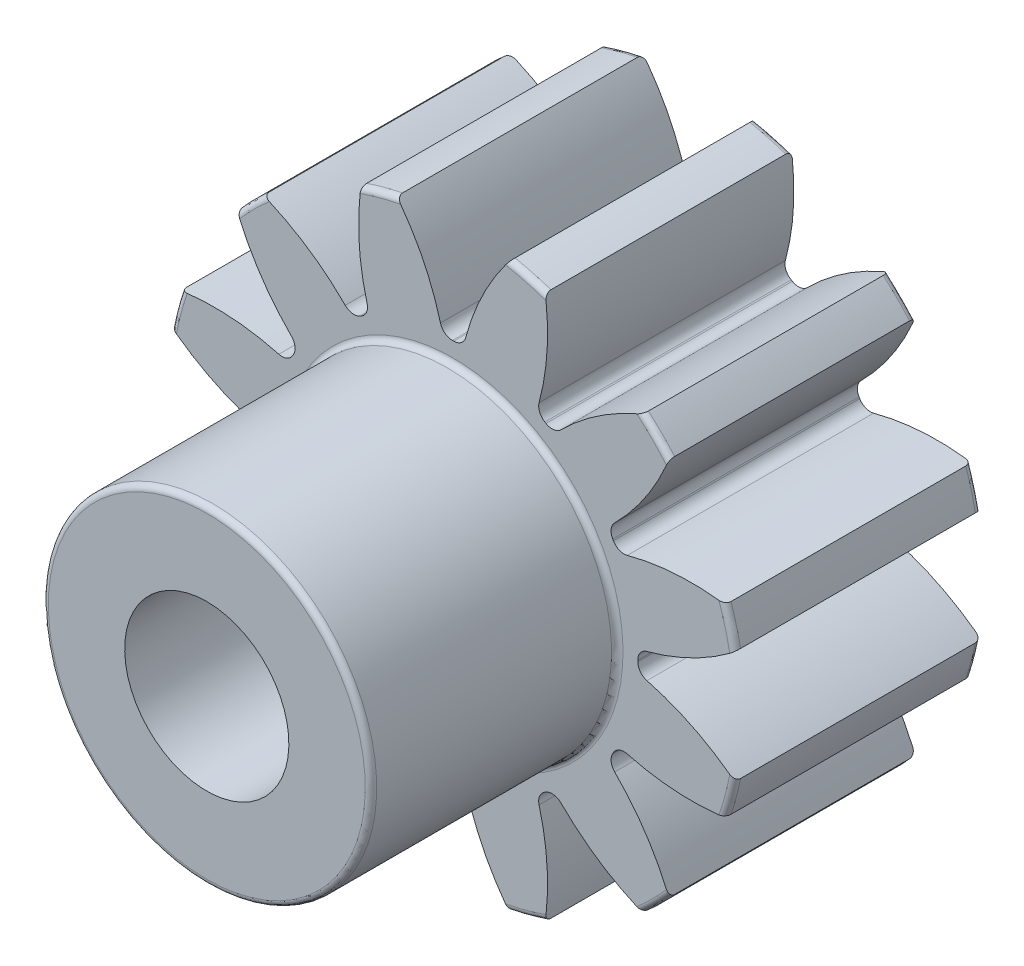
from build123d import *

# Parameters (mm, degrees)
FILLET2_R          = 0.14
CUT_EXTRUDE2_DEPTH = 12.575837024
CIRPATTERN1_COUNT  = 12


with BuildPart() as part:
    # Sketch4 → Revolve1 (revolve)
    with BuildSketch(Plane(origin=(0, 0, 0), x_dir=(0, 0, -1), z_dir=(1, 0, 0))):
        Polygon((-12, 2), (-12, 4), (-6, 4), (-6, 7), (0, 7), (0, 2), align=None)
    revolve(axis=Axis((0, 0, 6), (0, 0, 1)))

    # Fillet2
    fillet2_edges = [part.edges().sort_by_distance(p)[0] for p in [
        (0, -4, 12),
        (0, -4, 6),
        (0, -7, 6),
        (0, -7, 0),
    ]]
    fillet(fillet2_edges, radius=FILLET2_R)

    # Sketch7 → Cut-Extrude2 (cut, through all)
    with BuildSketch(Plane.XY.offset(6)):
        with BuildLine():
            ThreePointArc((-0.016433478, 4.499969993), (0, 4.5), (0.016433478, 4.499969993))
            ThreePointArc((0.016433478, 4.499969993), (0.199907289, 4.561764499), (0.307439354, 4.722755355))
            ThreePointArc((0.307439354, 4.722755355), (0.731505846, 5.847106195), (1.371117638, 6.864403574))
            ThreePointArc((1.371117638, 6.864403574), (0, 7), (-1.371117638, 6.864403574))
            ThreePointArc((-1.371117638, 6.864403574), (-0.731505846, 5.847106195), (-0.307439354, 4.722755355))
            ThreePointArc((-0.307439354, 4.722755355), (-0.199907289, 4.561764499), (-0.016433478, 4.499969993))
        make_face()
    cut_extrude2 = extrude(amount=-CUT_EXTRUDE2_DEPTH, mode=Mode.SUBTRACT)

    # CirPattern1: Cut-Extrude2 ×12 about axis
    cirpattern1_axis = Axis((0, 0, 12), (0, 0, -1))
    for i in range(1, CIRPATTERN1_COUNT):
        add(cut_extrude2.rotate(cirpattern1_axis, i * 360 / CIRPATTERN1_COUNT), mode=Mode.SUBTRACT)


solid = part.part
